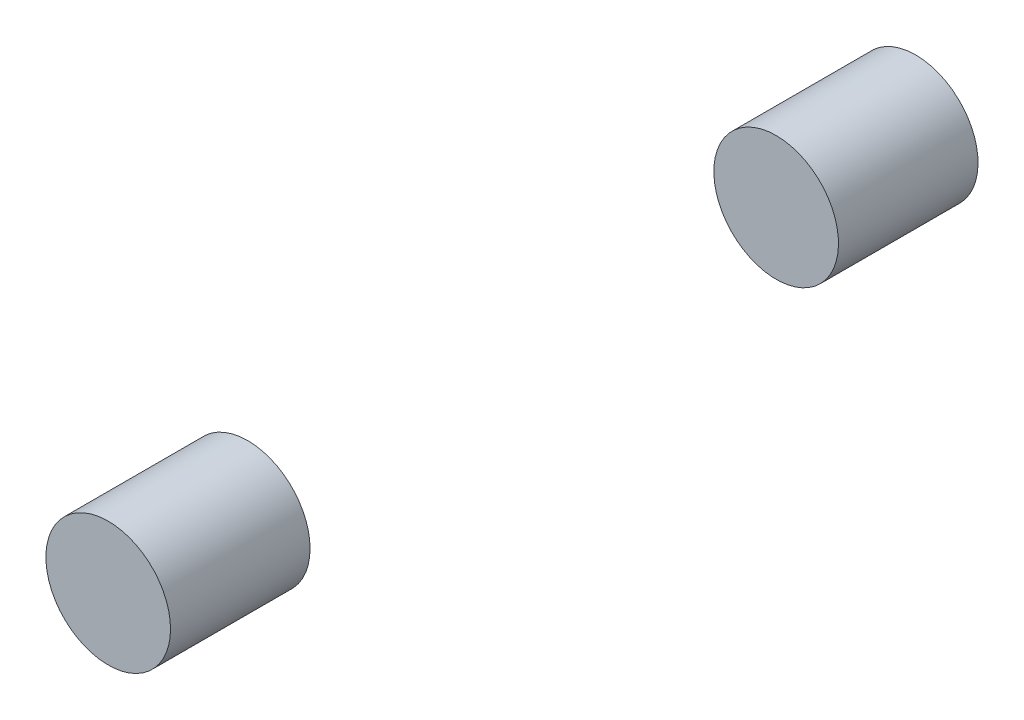
from build123d import *

# Parameters (mm, degrees)
BOSS_EXTRUDE1_START     = -14.219322913
BOSS_EXTRUDE1_OUTLINE_R = 6.35
BOSS_EXTRUDE1_DEPTH     = 14.219322913
SKETCH3_R               = 6.35
BOSS_EXTRUDE2_DEPTH     = 14.219322913


# Read off the part's stored shape, not the designer's step: Boss-Extrude1
with BuildPart() as part:
    # Boss-Extrude1 outline → Boss-Extrude1 (new body)
    with BuildSketch(Plane.XY.offset(59.426645827).offset(BOSS_EXTRUDE1_START)):
        Circle(BOSS_EXTRUDE1_OUTLINE_R)
    extrude(amount=BOSS_EXTRUDE1_DEPTH)


with BuildPart() as body_2:
    # Sketch3 → Boss-Extrude2 (new body)
    with BuildSketch(Plane(origin=(0, 0, -8.640677087), x_dir=(-1, 0, 0), z_dir=(0, 0, -1))):
        with Locations(Location((0, 0, 0), (0, 0, 90))):
            Circle(SKETCH3_R)
    extrude(amount=BOSS_EXTRUDE2_DEPTH)


solid = Compound([part.part, body_2.part])
